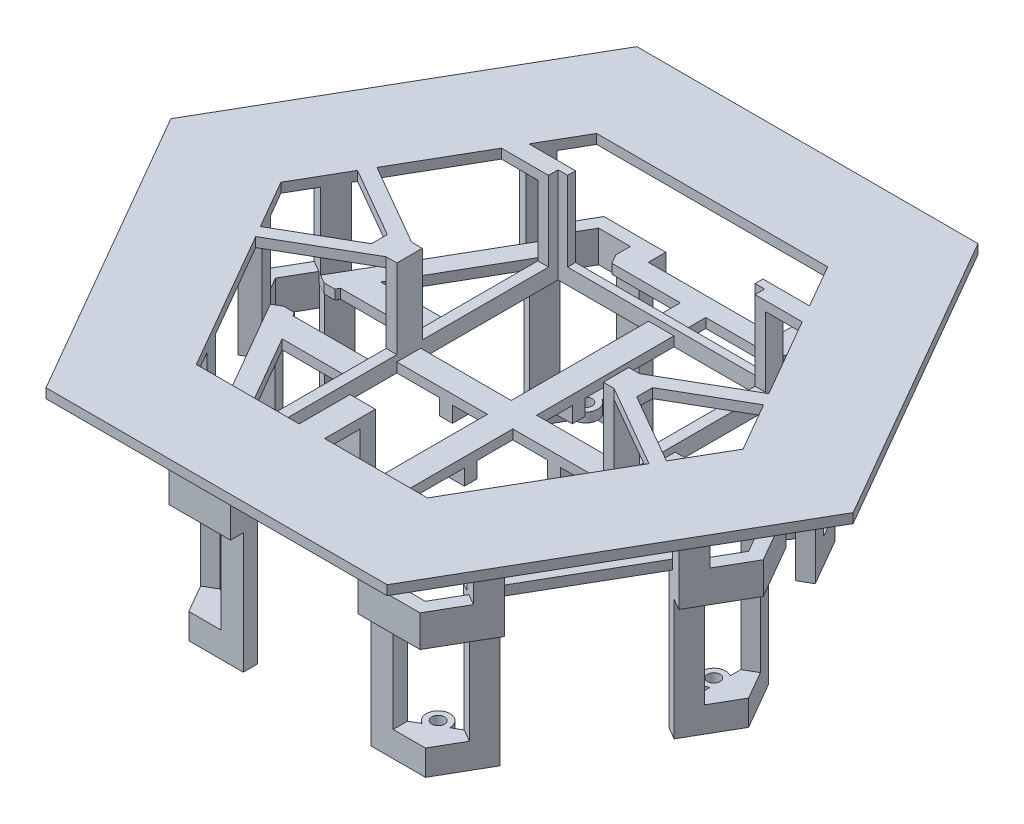
from build123d import *

# Parameters (mm, degrees)
SKETCH2_R             = 2
LEG1BOTTOMPART_DEPTH  = 3
LEG1EXTEND_DEPTH      = 8
SKETCH7_W             = 7
SKETCH7_H             = 4.5
LEG1ELEVATE_DEPTH     = 40
LEG1CLOSE_DEPTH       = 3
CROWN_DEPTH           = 3
SCREWDRIVERHOLE_DEPTH = 10
NEWBOND_DEPTH         = 10
CUT_EXTRUDE2_REACH    = 112.852
CIRPATTERN4_START     = 3
CIRPATTERN4_OUTLINE_W = 7
CIRPATTERN4_OUTLINE_H = 4.5
CIRPATTERN4_DEPTH     = 40
CIRPATTERN4_START_2   = 33
CIRPATTERN4_2_DEPTH   = 10
CIRPATTERN4_START_3   = 40
CIRPATTERN4_3_DEPTH   = 3
CIRPATTERN5_COUNT     = 6
CIRPATTERN6_COUNT     = 6
SKETCH12_W            = 28.5
SKETCH12_H            = 43.252842378
BPACKBASE_DEPTH       = 3
SKETCH13_W            = 8
SKETCH13_H            = 4
SKETCH13_W_2          = 4
SKETCH13_H_2          = 7.494315244
SUPPORTS_DEPTH        = 5
SKETCH18_W            = 3.369307493
SKETCH18_H            = 8
SKETCH18_W_2          = 8
SKETCH18_H_2          = 4.87253699
SKETCH18_W_3          = 7.145081595
SKETCH18_H_3          = 5.5
BASE_DEPTH            = 27
HAT_DEPTH             = 3
SKETCH21_W            = 8
SKETCH21_H            = 16
BATTERYIOSLOT_DEPTH   = 27
BOSS_EXTRUDE2_DEPTH   = 27
BOSS_EXTRUDE3_DEPTH   = 3
SKETCH22_W            = 71.738614986
SKETCH22_H            = 99
SKETCH22_W_2          = 65
SKETCH22_H_2          = 94
BTRBORDER_DEPTH       = 2
PLATFORM_DEPTH        = 3
CUT_EXTRUDE3_REACH    = 208.19
SKETCH29_W            = 7.145081595
SKETCH29_H            = 24


# Read off the part's stored shape, not the designer's step: CirPattern4
with BuildPart() as part:
    # Sketch2 → leg1bottompart (new body)
    with BuildSketch(Plane(origin=(0, 0, 0), x_dir=(1, 0, 0), z_dir=(0, 1, 0))):
        with BuildLine():
            Line((-38.414518843, -53.464101615), (-34.641016151, -60))
            Line((-34.641016151, -60), (-27.094010768, -60))
            Line((-27.094010768, -60), (-30.007107183, -58.318123))
            ThreePointArc((-30.007107183, -58.318123), (-29.207846709, -57.752863033), (-28.58212042, -57))
            ThreePointArc((-28.58212042, -57), (-29.879264805, -51.752404736), (-35.072387806, -53.252842378))
            ThreePointArc((-35.072387806, -53.252842378), (-35.411523173, -54.171168757), (-35.501422427, -55.145978615))
            Line((-35.501422427, -55.145978615), (-38.414518843, -53.464101615))
        make_face()
        with Locations(Location((-31.754264805, -55, 0), (0, 0, 270))):
            Circle(SKETCH2_R, mode=Mode.SUBTRACT)
    leg1bottompart = extrude(amount=LEG1BOTTOMPART_DEPTH)

    # Sketch6 → Leg1Extend (add)
    with BuildSketch(Plane(origin=(0, 3, 0), x_dir=(1, 0, 0), z_dir=(0, 1, 0))):
        Polygon((-42.31163316, -55.714101615), (-37.239092363, -64.5), (-27.094010768, -64.5), (-20.094010768, -64.5), (-20.094010768, -60), (-27.094010768, -60), (-34.641016151, -60), (-38.414518843, -53.464101615), (-41.914518843, -47.401923789), (-45.81163316, -49.651923789), align=None)
    leg1extend = extrude(amount=-LEG1EXTEND_DEPTH)

    # Sketch7 → Leg1Elevate (add)
    with BuildSketch(Plane(origin=(0, 3, 0), x_dir=(1, 0, 0), z_dir=(0, 1, 0))):
        Polygon((-38.414518843, -53.464101615), (-42.31163316, -55.714101615), (-45.81163316, -49.651923789), (-41.914518843, -47.401923789), align=None)
        with Locations((-23.594010768, -62.25)):
            Rectangle(SKETCH7_W, SKETCH7_H)
    extrude(amount=LEG1ELEVATE_DEPTH)

    # Sketch8 → Leg1Close (add)
    with BuildSketch(Plane(origin=(0, 43, 0), x_dir=(1, 0, 0), z_dir=(0, 1, 0))):
        Polygon((-38.414518843, -53.464101615), (-34.641016151, -60), (-27.094010768, -60), (-27.094010768, -64.5), (-37.239092363, -64.5), (-42.31163316, -55.714101615), align=None)
    extrude(amount=-LEG1CLOSE_DEPTH)

    # Sketch9 → Crown (add)
    with BuildSketch(Plane(origin=(0, 43, 0), x_dir=(1, 0, 0), z_dir=(0, 1, 0))):
        Polygon((-28.58212042, -63), (36.373066959, -63), (72.746133918, 0), (36.373066959, 63), (-36.373066959, 63), (-72.746133918, 0), (-40.268540228, -56.252842378), (-36.373066959, -63), align=None)
        Polygon((-28.58212042, -57), (32.908965344, -57), (65.817930688, 0), (32.908965344, 57), (-32.908965344, 57), (-65.817930688, 0), (-35.072387806, -53.252842378), (-32.908965344, -57), align=None, mode=Mode.SUBTRACT)
    extrude(amount=-CROWN_DEPTH)

    # Sketch23 → ScrewdriverHole (cut)
    with BuildSketch(Plane(origin=(0, 43, 0), x_dir=(1, 0, 0), z_dir=(0, 1, 0))):
        Polygon((-35.743901834, -52.089745962), (-42.239092363, -55.839745962), (-37.239092363, -64.5), (-27.239092363, -64.5), (-27.239092363, -57), (-32.908965344, -57), align=None)
    screwdriverhole = extrude(amount=-SCREWDRIVERHOLE_DEPTH, mode=Mode.SUBTRACT)

    # Sketch24 → NewBond (add)
    with BuildSketch(Plane(origin=(0, 43, 0), x_dir=(1, 0, 0), z_dir=(0, 1, 0))):
        Polygon((-37.239092363, -64.5), (-45.81163316, -49.651923789), (-49.275734775, -51.651923789), (-39.548493439, -68.5), (-20.094010768, -68.5), (-20.094010768, -64.5), align=None)
    extrude(amount=-NEWBOND_DEPTH)

    # Sketch25 → Cut-Extrude2 (cut, up to next)
    with BuildSketch(Plane(origin=(0, 43, 0), x_dir=(1, 0, 0), z_dir=(0, 1, 0)), mode=Mode.PRIVATE) as cut_extrude2_sk1:
        Polygon((-38.269437248, -53.547864513), (-36.585746972, -50.631627411), (-35.743901834, -52.089745962), align=None)
    cut_extrude2_tool1 = extrude(cut_extrude2_sk1.sketch, amount=-CUT_EXTRUDE2_REACH, mode=Mode.PRIVATE) & part.part
    # Sketch25 → Cut-Extrude2 (cut, up to next)
    with BuildSketch(Plane(origin=(0, 43, 0), x_dir=(1, 0, 0), z_dir=(0, 1, 0)), mode=Mode.PRIVATE) as cut_extrude2_sk2:
        Polygon((-27.239092363, -59.916237102), (-27.239092363, -57), (-25.555402087, -57), align=None)
    cut_extrude2_tool2 = extrude(cut_extrude2_sk2.sketch, amount=-CUT_EXTRUDE2_REACH, mode=Mode.PRIVATE) & part.part
    cut_extrude2_1 = cut_extrude2_tool1.solids().sort_by_distance((-36.866362, 43, 52.089746))[0]
    add(cut_extrude2_1, mode=Mode.SUBTRACT)
    cut_extrude2_2 = cut_extrude2_tool2.solids().sort_by_distance((-26.677862, 43, 57.972079))[0]
    add(cut_extrude2_2, mode=Mode.SUBTRACT)
    cut_extrude2 = cut_extrude2_1 + cut_extrude2_2  # Cut-Extrude2 as one shape, for the pattern or mirror that repeats it

    # CirPattern4 outline → CirPattern4 (add)
    with BuildSketch(Plane(origin=(0, 0, 0), x_dir=(1, 0, 0), z_dir=(0, 1, 0)).offset(CIRPATTERN4_START)):
        Polygon((45.81163316, -49.651923789), (41.914518843, -47.401923789), (38.414518843, -53.464101615), (42.31163316, -55.714101615), align=None)
        Polygon((65.905643928, 14.848076211), (62.008529611, 12.598076211), (65.508529611, 6.535898385), (69.405643928, 8.785898385), align=None)
        with Locations((23.594010768, 62.25)):
            Rectangle(CIRPATTERN4_OUTLINE_W, CIRPATTERN4_OUTLINE_H)
        Polygon((-45.81163316, 49.651923789), (-41.914518843, 47.401923789), (-38.414518843, 53.464101615), (-42.31163316, 55.714101615), align=None)
        Polygon((-62.008529611, -12.598076211), (-65.508529611, -6.535898385), (-69.405643928, -8.785898385), (-65.905643928, -14.848076211), align=None)
        Polygon((-62.008529611, 12.598076211), (-65.905643928, 14.848076211), (-69.405643928, 8.785898385), (-65.508529611, 6.535898385), align=None)
        with Locations((-23.594010768, 62.25)):
            Rectangle(CIRPATTERN4_OUTLINE_W, CIRPATTERN4_OUTLINE_H)
        Polygon((41.914518843, 47.401923789), (45.81163316, 49.651923789), (42.31163316, 55.714101615), (38.414518843, 53.464101615), align=None)
        Polygon((62.008529611, -12.598076211), (65.905643928, -14.848076211), (69.405643928, -8.785898385), (65.508529611, -6.535898385), align=None)
        with Locations((23.594010768, -62.25)):
            Rectangle(CIRPATTERN4_OUTLINE_W, CIRPATTERN4_OUTLINE_H)
    extrude(amount=CIRPATTERN4_DEPTH)

    # CirPattern4 2 outline → CirPattern4 2 (add)
    with BuildSketch(Plane(origin=(0, 0, 0), x_dir=(1, 0, 0), z_dir=(0, 1, 0)).offset(CIRPATTERN4_START_2)):
        Polygon((-65.905643928, -14.848076211), (-69.405643928, -8.785898385), (-74.478184725, 0), (-69.405643928, 8.785898385), (-65.905643928, 14.848076211), (-69.369745543, 16.848076211), (-79.096986879, 0), (-69.369745543, -16.848076211), align=None)
        Polygon((-49.275734775, 51.651923789), (-45.81163316, 49.651923789), (-42.31163316, 55.714101615), (-37.239092363, 64.5), (-20.094010768, 64.5), (-20.094010768, 68.5), (-39.548493439, 68.5), align=None)
        Polygon((20.094010768, 68.5), (20.094010768, 64.5), (37.239092363, 64.5), (42.31163316, 55.714101615), (45.81163316, 49.651923789), (49.275734775, 51.651923789), (39.548493439, 68.5), align=None)
        Polygon((69.369745543, 16.848076211), (65.905643928, 14.848076211), (69.405643928, 8.785898385), (74.478184725, 0), (69.405643928, -8.785898385), (65.905643928, -14.848076211), (69.369745543, -16.848076211), (79.096986879, 0), align=None)
        Polygon((49.275734775, -51.651923789), (45.81163316, -49.651923789), (42.31163316, -55.714101615), (37.239092363, -64.5), (20.094010768, -64.5), (20.094010768, -68.5), (39.548493439, -68.5), align=None)
    extrude(amount=CIRPATTERN4_2_DEPTH)

    # CirPattern4 3 outline → CirPattern4 3 (add)
    with BuildSketch(Plane(origin=(0, 0, 0), x_dir=(1, 0, 0), z_dir=(0, 1, 0)).offset(CIRPATTERN4_START_3)):
        Polygon((-69.405643928, -8.785898385), (-68.106605822, -8.035898385), (-72.746133918, 0), (-68.106605822, 8.035898385), (-69.405643928, 8.785898385), (-74.478184725, 0), align=None)
        Polygon((-42.31163316, 55.714101615), (-41.012595055, 54.964101615), (-36.373066959, 63), (-27.094010768, 63), (-27.094010768, 64.5), (-37.239092363, 64.5), align=None)
        Polygon((27.094010768, 64.5), (27.094010768, 63), (36.373066959, 63), (41.012595055, 54.964101615), (42.31163316, 55.714101615), (37.239092363, 64.5), align=None)
        Polygon((69.405643928, 8.785898385), (68.106605822, 8.035898385), (72.746133918, 0), (68.106605822, -8.035898385), (69.405643928, -8.785898385), (74.478184725, 0), align=None)
        Polygon((42.31163316, -55.714101615), (41.012595055, -54.964101615), (36.373066959, -63), (27.094010768, -63), (27.094010768, -64.5), (37.239092363, -64.5), align=None)
    extrude(amount=CIRPATTERN4_3_DEPTH)

    # CirPattern5: Leg1Extend ×6 about axis
    cirpattern5_axis = Axis((0, 0, 0), (0, 1, 0))
    for i in range(1, CIRPATTERN5_COUNT):
        add(leg1extend.rotate(cirpattern5_axis, i * 360 / CIRPATTERN5_COUNT))

    # CirPattern6: leg1bottompart, ScrewdriverHole, Cut-Extrude2 ×6 about axis
    cirpattern6_axis = Axis((0, 0, 0), (0, 1, 0))
    add([leg1bottompart.rotate(cirpattern6_axis, i * 360 / CIRPATTERN6_COUNT) for i in range(1, CIRPATTERN6_COUNT)])
    add([screwdriverhole.rotate(cirpattern6_axis, i * 360 / CIRPATTERN6_COUNT) for i in range(1, CIRPATTERN6_COUNT)], mode=Mode.SUBTRACT)
    add([cut_extrude2.rotate(cirpattern6_axis, i * 360 / CIRPATTERN6_COUNT) for i in range(1, CIRPATTERN6_COUNT)], mode=Mode.SUBTRACT)

    # Sketch12 → BPackBase (add)
    with BuildSketch(Plane(origin=(0, 43, 0), x_dir=(1, 0, 0), z_dir=(0, 1, 0))):
        Polygon((-35.869307493, 49.5), (-4, 49.5), (-4, 57), (4, 57), (4, 49.5), (35.869307493, 49.5), (37.239092363, 49.5), (38.682468036, 47), (35.869307493, 47), (35.869307493, 15.5), (56.869001515, 15.5), (61.487803669, 7.5), (35.869307493, 7.5), (35.869307493, -7.5), (61.487803669, -7.5), (56.869001515, -15.5), (35.869307493, -15.5), (35.869307493, -47), (38.682468036, -47), (37.239092363, -49.5), (35.869307493, -49.5), (4, -49.5), (4, -57), (-4, -57), (-4, -49.5), (-35.869307493, -49.5), (-37.239092363, -49.5), (-38.682468036, -47), (-35.869307493, -47), (-35.869307493, -15.5), (-56.869001515, -15.5), (-61.487803669, -7.5), (-35.869307493, -7.5), (-35.869307493, 7.5), (-61.487803669, 7.5), (-56.869001515, 15.5), (-35.869307493, 15.5), (-35.869307493, 47), (-38.682468036, 47), (-37.239092363, 49.5), align=None)
        with Locations((-18.25, -25.373578811)):
            Rectangle(SKETCH12_W, SKETCH12_H, mode=Mode.SUBTRACT)
        with Locations((18.25, 25.373578811)):
            Rectangle(SKETCH12_W, SKETCH12_H, mode=Mode.SUBTRACT)
        with Locations((-18.25, 25.373578811)):
            Rectangle(SKETCH12_W, SKETCH12_H, mode=Mode.SUBTRACT)
        with Locations((18.25, -25.373578811)):
            Rectangle(SKETCH12_W, SKETCH12_H, mode=Mode.SUBTRACT)
    extrude(amount=-BPACKBASE_DEPTH)

    # Sketch13 → Supports (add)
    with BuildSketch(Plane.XZ.offset(-40)):
        with Locations((0, -17)):
            Rectangle(SKETCH13_W, SKETCH13_H)
        with Locations((17, 0)):
            Rectangle(SKETCH13_W_2, SKETCH13_H_2)
        with Locations((-17, 0)):
            Rectangle(SKETCH13_W_2, SKETCH13_H_2)
        with Locations((0, 17)):
            Rectangle(SKETCH13_W, SKETCH13_H)
    extrude(amount=SUPPORTS_DEPTH)

    # Sketch18 → Base (add)
    with BuildSketch(Plane(origin=(0, 43, 0), x_dir=(1, 0, 0), z_dir=(0, 1, 0))):
        with Locations((-34.184653747, 0.252842378)):
            Rectangle(SKETCH18_W, SKETCH18_H)
        with Locations((0, 49.436268495)):
            Rectangle(SKETCH18_W_2, SKETCH18_H_2)
        with Locations((0, -49.436268495)):
            Rectangle(SKETCH18_W_2, SKETCH18_H_2)
        with Locations((34.184653747, 0.252842378)):
            Rectangle(SKETCH18_W, SKETCH18_H)
        Polygon((-44.512595055, -48.901923789), (-49.275734775, -51.651923789), (-45.703193978, -57.839745962), (-40.940054257, -55.089745962), align=None)
        with Locations((-23.666551566, -65.75)):
            Rectangle(SKETCH18_W_3, SKETCH18_H_3)
        Polygon((-68.17914662, 7.910254038), (-72.942286341, 10.660254038), (-69.369745543, 16.848076211), (-64.606605822, 14.098076211), align=None)
        Polygon((-72.942286341, -10.660254038), (-69.369745543, -16.848076211), (-64.606605822, -14.098076211), (-68.17914662, -7.910254038), align=None)
        with Locations((-23.666551566, 65.75)):
            Rectangle(SKETCH18_W_3, SKETCH18_H_3)
        Polygon((-45.703193978, 57.839745962), (-49.275734775, 51.651923789), (-44.512595055, 48.901923789), (-40.940054257, 55.089745962), align=None)
        Polygon((40.940054257, 55.089745962), (45.703193978, 57.839745962), (49.275734775, 51.651923789), (44.512595055, 48.901923789), align=None)
        with Locations((23.666551566, 65.75)):
            Rectangle(SKETCH18_W_3, SKETCH18_H_3)
        Polygon((68.17914662, -7.910254038), (72.942286341, -10.660254038), (69.369745543, -16.848076211), (64.606605822, -14.098076211), align=None)
        Polygon((72.942286341, 10.660254038), (69.369745543, 16.848076211), (64.606605822, 14.098076211), (68.17914662, 7.910254038), align=None)
        with Locations((23.666551566, -65.75)):
            Rectangle(SKETCH18_W_3, SKETCH18_H_3)
        Polygon((45.703193978, -57.839745962), (49.275734775, -51.651923789), (44.512595055, -48.901923789), (40.940054257, -55.089745962), align=None)
    extrude(amount=BASE_DEPTH)

    # Sketch19 → Hat (add)
    with BuildSketch(Plane(origin=(0, 70, 0), x_dir=(1, 0, 0), z_dir=(0, 1, 0))):
        Polygon((39.259818305, -68), (78.51963661, 0), (39.259818305, 68), (-39.259818305, 68), (-78.51963661, 0), (-39.259818305, -68), align=None)
        Polygon((-41.746133918, -2.5), (-41.746133918, 2.5), (-63.913602163, 15.298393759), (-72.746133918, 0), (-63.913602163, -15.298393759), align=None, mode=Mode.SUBTRACT)
        Polygon((35.869307493, 4.252842378), (61.685392543, 19.157766031), (36.373066959, 63), (4, 63), (4, 51.87253699), (-4, 51.87253699), (-4, 63), (-36.373066959, 63), (-61.685392543, 19.157766031), (-35.869307493, 4.252842378), (-35.869307493, -3.747157622), (-61.904360465, -18.778502464), (-36.373066959, -63), (-4, -63), (-4, -51.87253699), (4, -51.87253699), (4, -63), (36.373066959, -63), (61.904360465, -18.778502464), (35.869307493, -3.747157622), align=None, mode=Mode.SUBTRACT)
        Polygon((41.746133918, -2.5), (41.746133918, 2.5), (63.913602163, 15.298393759), (72.746133918, 0), (63.913602163, -15.298393759), align=None, mode=Mode.SUBTRACT)
    extrude(amount=-HAT_DEPTH)

    # Sketch21 → BatteryIOSlot (cut)
    with BuildSketch(Plane(origin=(0, 70, 0), x_dir=(1, 0, 0), z_dir=(0, 1, 0))):
        with Locations((0, 55)):
            Rectangle(SKETCH21_W, SKETCH21_H)
    extrude(amount=-BATTERYIOSLOT_DEPTH, mode=Mode.SUBTRACT)

    # Sketch27 → Boss-Extrude2 (add)
    with BuildSketch(Plane(origin=(0, 43, 0), x_dir=(1, 0, 0), z_dir=(0, 1, 0))):
        Polygon((32.5, 44), (32.5, 47), (29.5, 47), (29.5, 49.5), (35.869307493, 49.5), (35.869307493, 44), align=None)
        Polygon((-29.5, 47), (-29.5, 49.5), (-35.869307493, 49.5), (-35.869307493, 44), (-32.5, 44), (-32.5, 47), align=None)
    extrude(amount=BOSS_EXTRUDE2_DEPTH)

    # Sketch28 → Boss-Extrude3 (add)
    with BuildSketch(Plane(origin=(0, 70, 0), x_dir=(1, 0, 0), z_dir=(0, 1, 0))):
        Polygon((-35.869307493, 44), (-47.342722074, 44), (-44.167295593, 49.5), (-35.869307493, 49.5), align=None)
        Polygon((35.869307493, 44), (35.869307493, 49.5), (44.167295593, 49.5), (47.342722074, 44), align=None)
    extrude(amount=-BOSS_EXTRUDE3_DEPTH)

    # Sketch22 → BTRBorder (add)
    with BuildSketch(Plane(origin=(0, 43, 0), x_dir=(1, 0, 0), z_dir=(0, 1, 0))):
        Rectangle(SKETCH22_W, SKETCH22_H)
        Rectangle(SKETCH22_W_2, SKETCH22_H_2, mode=Mode.SUBTRACT)
    extrude(amount=BTRBORDER_DEPTH)

    # Sketch20 → Platform (add)
    with BuildSketch(Plane(origin=(0, 70, 0), x_dir=(1, 0, 0), z_dir=(0, 1, 0))):
        Polygon((53.693575035, -93), (107.387150069, 0), (53.693575035, 93), (-53.693575035, 93), (-107.387150069, 0), (-53.693575035, -93), align=None)
        Polygon((36.373066959, -63), (72.746133918, 0), (36.373066959, 63), (-36.373066959, 63), (-72.746133918, 0), (-36.373066959, -63), align=None, mode=Mode.SUBTRACT)
    extrude(amount=-PLATFORM_DEPTH)

    # Sketch29 → Cut-Extrude3 (cut, up to next)
    with BuildSketch(Plane(origin=(0, 0, -68.5), x_dir=(-1, 0, 0), z_dir=(0, 0, -1)), mode=Mode.PRIVATE) as cut_extrude3_sk1:
        with Locations((-23.666551566, 55)):
            Rectangle(SKETCH29_W, SKETCH29_H)
    cut_extrude3_tool1 = extrude(cut_extrude3_sk1.sketch, amount=-CUT_EXTRUDE3_REACH, mode=Mode.PRIVATE) & part.part
    # Sketch29 → Cut-Extrude3 (cut, up to next)
    with BuildSketch(Plane(origin=(0, 0, -68.5), x_dir=(-1, 0, 0), z_dir=(0, 0, -1)), mode=Mode.PRIVATE) as cut_extrude3_sk2:
        with Locations((23.666551566, 55)):
            Rectangle(SKETCH29_W, SKETCH29_H)
    cut_extrude3_tool2 = extrude(cut_extrude3_sk2.sketch, amount=-CUT_EXTRUDE3_REACH, mode=Mode.PRIVATE) & part.part
    add(cut_extrude3_tool1.solids().sort_by_distance((23.666552, 55, -68.5))[0], mode=Mode.SUBTRACT)
    add(cut_extrude3_tool2.solids().sort_by_distance((-23.666552, 55, -68.5))[0], mode=Mode.SUBTRACT)


solid = part.part
